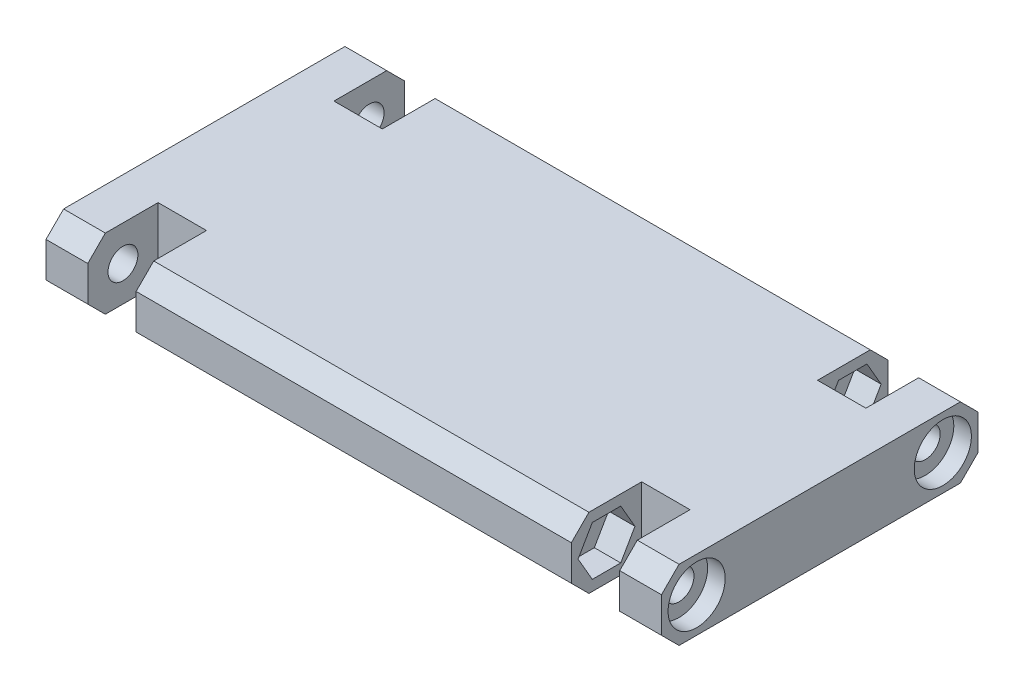
from build123d import *

# Parameters (mm, degrees)
SKETCH1_W                                  = 70
SKETCH1_H                                  = 36
BOSS_EXTRUDE1_DEPTH                        = 8
SKETCH2_W                                  = 5.5
SKETCH2_H                                  = 8
CUT_EXTRUDE1_DEPTH                         = 41.162171256
CBORE_START                                = 33
CBORE_FOR_M3_CHEESE_HEAD_SCREW1_OUTLINE_R  = 3.25
CBORE_FOR_M3_CHEESE_HEAD_SCREW1_DEPTH      = 2
CBORE_START_2                              = 30.25
CBORE_FOR_M3_CHEESE_HEAD_SCREW1_2_OUTLIN_R = 1.7
CBORE_FOR_M3_CHEESE_HEAD_SCREW1_2_DEPTH    = 2.75
CUT_EXTRUDE2_DEPTH                         = 3
MIRROR2_START                              = 33
MIRROR2_COPY_1_SKETCH_R                    = 3.25
MIRROR2_COPY_1_DEPTH                       = 2
MIRROR2_START_2                            = 30.25
MIRROR2_COPY_2_SKETCH_R                    = 1.7
MIRROR2_COPY_2_DEPTH                       = 2.75
MIRROR2_COPY_3_DEPTH                       = 3
MIRROR2_COPY_4_SKETCH_R                    = 1.7
MIRROR2_COPY_4_DEPTH                       = 2.75
CHAMFER1_SIZE                              = 2


# Read off the part's stored shape, not the designer's step: CBORE for M3 Cheese Head Screw1
with BuildPart() as part:
    # Sketch1 → Boss-Extrude1 (new body)
    with BuildSketch(Plane(origin=(0, 0, 0), x_dir=(1, 0, 0), z_dir=(0, 1, 0))):
        Rectangle(SKETCH1_W, SKETCH1_H)
    extrude(amount=BOSS_EXTRUDE1_DEPTH)

    # Sketch2 → Cut-Extrude1 (cut, through all)
    with BuildSketch(Plane(origin=(0, 8, 0), x_dir=(1, 0, 0), z_dir=(0, 1, 0))):
        with Locations((-27.5, 14)):
            Rectangle(SKETCH2_W, SKETCH2_H)
        with Locations((27.5, 14)):
            Rectangle(SKETCH2_W, SKETCH2_H)
    cut_extrude1 = extrude(amount=-CUT_EXTRUDE1_DEPTH, mode=Mode.SUBTRACT)

    # CBORE for M3 Cheese Head Screw1 outline → CBORE for M3 Cheese Head Screw1 (cut)
    with BuildSketch(Plane.YZ.offset(CBORE_START)):
        with Locations((4, -14)):
            Circle(CBORE_FOR_M3_CHEESE_HEAD_SCREW1_OUTLINE_R)
    cbore_for_m3_cheese_head_screw1 = extrude(amount=CBORE_FOR_M3_CHEESE_HEAD_SCREW1_DEPTH, mode=Mode.SUBTRACT)

    # CBORE for M3 Cheese Head Screw1 2 outlin → CBORE for M3 Cheese Head Screw1 2 (cut)
    with BuildSketch(Plane.YZ.offset(CBORE_START_2)):
        with Locations((4, -14)):
            Circle(CBORE_FOR_M3_CHEESE_HEAD_SCREW1_2_OUTLIN_R)
    cbore_for_m3_cheese_head_screw1_2 = extrude(amount=CBORE_FOR_M3_CHEESE_HEAD_SCREW1_2_DEPTH, mode=Mode.SUBTRACT)

    # Sketch9 → Cut-Extrude2 (cut)
    with BuildSketch(Plane(origin=(24.75, 0, 0), x_dir=(0, 0, -1), z_dir=(1, 0, 0))):
        Polygon((15.616580754, 6.8), (12.383419246, 6.8), (10.766838493, 4), (12.383419246, 1.2), (15.616580754, 1.2), (17.233161507, 4), align=None)
    cut_extrude2 = extrude(amount=-CUT_EXTRUDE2_DEPTH, mode=Mode.SUBTRACT)

    # Mirror1: CBORE for M3 Cheese Head Screw1, CBORE for M3 Cheese Head Screw1 2, Cut-Extrude2 across plane
    add(cbore_for_m3_cheese_head_screw1.mirror(Plane(origin=(0, 0, 0), x_dir=(0, 0, 1), z_dir=(1, 0, 0))), mode=Mode.SUBTRACT)
    add(cbore_for_m3_cheese_head_screw1_2.mirror(Plane(origin=(0, 0, 0), x_dir=(0, 0, 1), z_dir=(1, 0, 0))), mode=Mode.SUBTRACT)
    add(cut_extrude2.mirror(Plane(origin=(0, 0, 0), x_dir=(0, 0, 1), z_dir=(1, 0, 0))), mode=Mode.SUBTRACT)

    # Mirror2: Cut-Extrude1, CBORE for M3 Cheese Head Screw1, CBORE for M3 Cheese Head Screw1 2, Cut-Extrude2 across plane
    add(cut_extrude1.mirror(Plane.XY), mode=Mode.SUBTRACT)
    add(cbore_for_m3_cheese_head_screw1.mirror(Plane.XY), mode=Mode.SUBTRACT)
    add(cbore_for_m3_cheese_head_screw1_2.mirror(Plane.XY), mode=Mode.SUBTRACT)
    add(cut_extrude2.mirror(Plane.XY), mode=Mode.SUBTRACT)

    # Mirror2 copy 1 sketch → Mirror2 copy 1 (cut)
    with BuildSketch(Plane(origin=(0, 0, 0), x_dir=(0, 1, 0), z_dir=(-1, 0, 0)).offset(MIRROR2_START)):
        with Locations((4, -14)):
            Circle(MIRROR2_COPY_1_SKETCH_R)
    extrude(amount=MIRROR2_COPY_1_DEPTH, mode=Mode.SUBTRACT)

    # Mirror2 copy 2 sketch → Mirror2 copy 2 (cut)
    with BuildSketch(Plane(origin=(0, 0, 0), x_dir=(0, 1, 0), z_dir=(-1, 0, 0)).offset(MIRROR2_START_2)):
        with Locations((4, -14)):
            Circle(MIRROR2_COPY_2_SKETCH_R)
    extrude(amount=MIRROR2_COPY_2_DEPTH, mode=Mode.SUBTRACT)

    # Mirror2 copy 3 sketch → Mirror2 copy 3 (cut)
    with BuildSketch(Plane.ZY.offset(24.75)):
        Polygon((15.616580754, 6.8), (12.383419246, 6.8), (10.766838493, 4), (12.383419246, 1.2), (15.616580754, 1.2), (17.233161507, 4), align=None)
    extrude(amount=-MIRROR2_COPY_3_DEPTH, mode=Mode.SUBTRACT)

    # Mirror2 copy 4 sketch → Mirror2 copy 4 (cut)
    with BuildSketch(Plane.YZ.offset(MIRROR2_START_2)):
        with Locations((4, 14)):
            Circle(MIRROR2_COPY_4_SKETCH_R)
    extrude(amount=MIRROR2_COPY_4_DEPTH, mode=Mode.SUBTRACT)

    # Chamfer1
    chamfer1_edges = [part.edges().sort_by_distance(p)[0] for p in [
        (32.625, 0, 18),
        (32.625, 8, 18),
        (-32.625, 8, 18),
        (-32.625, 0, -18),
        (-32.625, 8, -18),
        (0, 0, -18),
        (0, 8, -18),
        (-32.625, 0, 18),
        (32.625, 0, -18),
        (32.625, 8, -18),
        (0, 0, 18),
        (0, 8, 18),
    ]]
    chamfer(chamfer1_edges, length=CHAMFER1_SIZE)


solid = part.part
